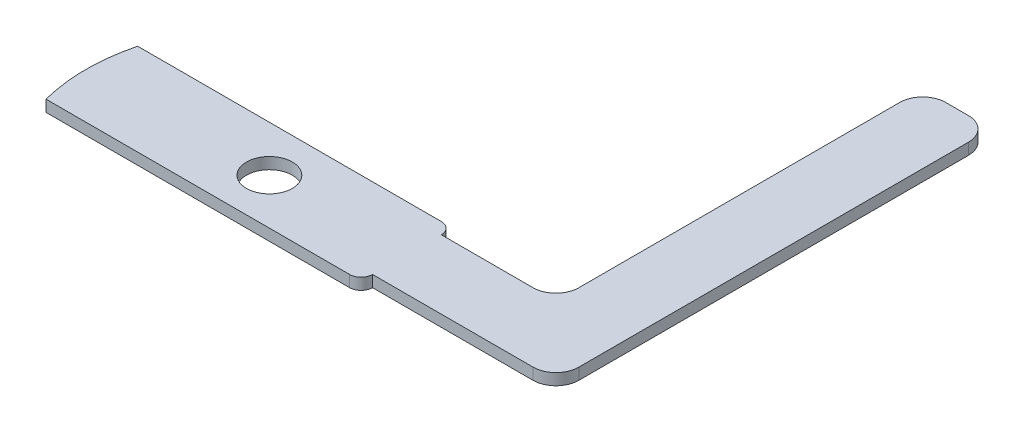
from build123d import *

# Parameters (mm, degrees)
SKETCH1_R           = 3.175
BOSS_EXTRUDE1_DEPTH = 1.5875
FILLET1_R           = 3.175
FILLET2_R           = 1.5875


with BuildPart() as part:
    # Sketch1 → Boss-Extrude1 (new body)
    with BuildSketch(Plane(origin=(0, 0, 0), x_dir=(1, 0, 0), z_dir=(0, 1, 0))):
        with BuildLine():
            Line((-30.943444248, 0), (12.7, 0))
            Line((12.7, 0), (12.7, 1.5875))
            Line((12.7, 1.5875), (38.1, 1.5875))
            Line((38.1, 1.5875), (38.1, 61.9125))
            Line((38.1, 61.9125), (28.575, 61.9125))
            Line((28.575, 61.9125), (28.575, 11.1125))
            Line((28.575, 11.1125), (12.7, 11.1125))
            Line((12.7, 11.1125), (12.7, 12.7))
            Line((12.7, 12.7), (-30.943444248, 12.7))
            ThreePointArc((-30.943444248, 12.7), (-31.75, 6.35), (-30.943444248, 0))
        make_face()
        with Locations(Location((-6.35, 6.35, 0), (0, 0, 270))):
            Circle(SKETCH1_R, mode=Mode.SUBTRACT)
    extrude(amount=BOSS_EXTRUDE1_DEPTH)

    # Fillet1
    fillet1_edges = [part.edges().sort_by_distance(p)[0] for p in [
        (28.575, 0.79375, -11.1125),
        (28.575, 0.79375, -61.9125),
        (38.1, 0.79375, -61.9125),
        (38.1, 0.79375, -1.5875),
    ]]
    fillet(fillet1_edges, radius=FILLET1_R)

    # Fillet2
    fillet2_edges = [part.edges().sort_by_distance(p)[0] for p in [
        (12.7, 0.79375, 0),
        (12.7, 0.79375, -12.7),
    ]]
    fillet(fillet2_edges, radius=FILLET2_R - 0.0001)  # a hair under: the kernel refuses the full size


solid = part.part
